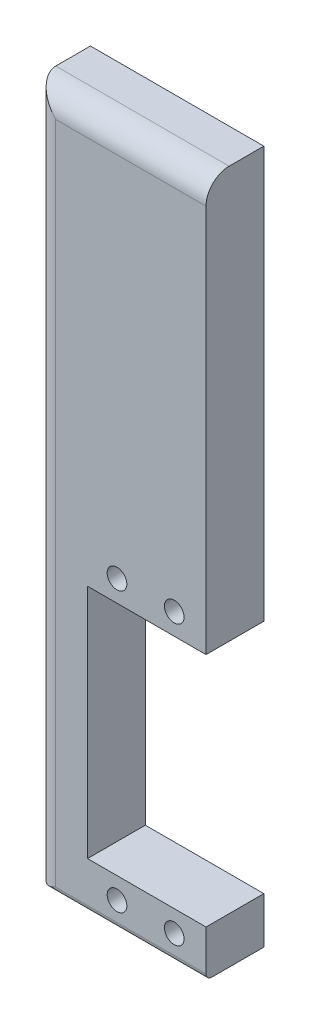
from build123d import *

# Parameters (mm, degrees)
SKETCH2_W           = 30
SKETCH2_H           = 120
BOSS_EXTRUDE1_DEPTH = 10
SKETCH3_R           = 1.7
SKETCH3_W           = 20.5
SKETCH3_H           = 40.8
CUT_EXTRUDE3_DEPTH  = 76.224148804
FILLET1_R           = 1
FILLET2_R           = 4


with BuildPart() as part:
    # Sketch2 → Boss-Extrude1 (new body)
    with BuildSketch(Plane.XY):
        with Locations((-15.991735537, -7.809917355)):
            Rectangle(SKETCH2_W, SKETCH2_H)
    extrude(amount=BOSS_EXTRUDE1_DEPTH)

    # Sketch3 → Cut-Extrude3 (cut, through all)
    with BuildSketch(Plane.XY):
        with Locations((-16.391735537, -63.486209282)):
            Circle(SKETCH3_R)
        with Locations((-6.491735537, -63.486209282)):
            Circle(SKETCH3_R)
        with Locations(Location((-6.491735537, -15.286209282, 0), (0, 0, 180))):
            Circle(SKETCH3_R)
        with Locations(Location((-16.391735537, -15.286209282, 0), (0, 0, 180))):
            Circle(SKETCH3_R)
        with Locations((-11.241735537, -39.386209282)):
            Rectangle(SKETCH3_W, SKETCH3_H)
    extrude(amount=CUT_EXTRUDE3_DEPTH, mode=Mode.SUBTRACT)

    # Fillet1
    fillet1_edges = [part.edges().sort_by_distance(p)[0] for p in [
        (-15.991735537, -67.809917355, 10),
    ]]
    fillet(fillet1_edges, radius=FILLET1_R)

    # Fillet2
    # the kernel refuses this fillet: 4 mm, written as the material it takes off along each edge
    with BuildSketch(Plane(origin=(-40.991735537, 52.190082645, 10), x_dir=(0, -1, 0), z_dir=(1, 0, 0))) as fillet2_piece_1:
        with BuildLine():
            CenterArc((FILLET2_R, FILLET2_R), FILLET2_R, 180, 90)
            Line((0, FILLET2_R), (0, 0))
            Line((0, 0), (FILLET2_R, 0))
        make_face()
    extrude(amount=50, mode=Mode.SUBTRACT)
    with BuildSketch(Plane(origin=(-30.991735537, -76.809917355, 10), x_dir=(0, 0, -1), z_dir=(0, 1, 0))) as fillet2_piece_2:
        with BuildLine():
            CenterArc((FILLET2_R, -FILLET2_R), FILLET2_R, 90, 90)
            Line((0, -FILLET2_R), (0, 0))
            Line((0, 0), (FILLET2_R, 0))
        make_face()
    extrude(amount=139, mode=Mode.SUBTRACT)


solid = part.part
